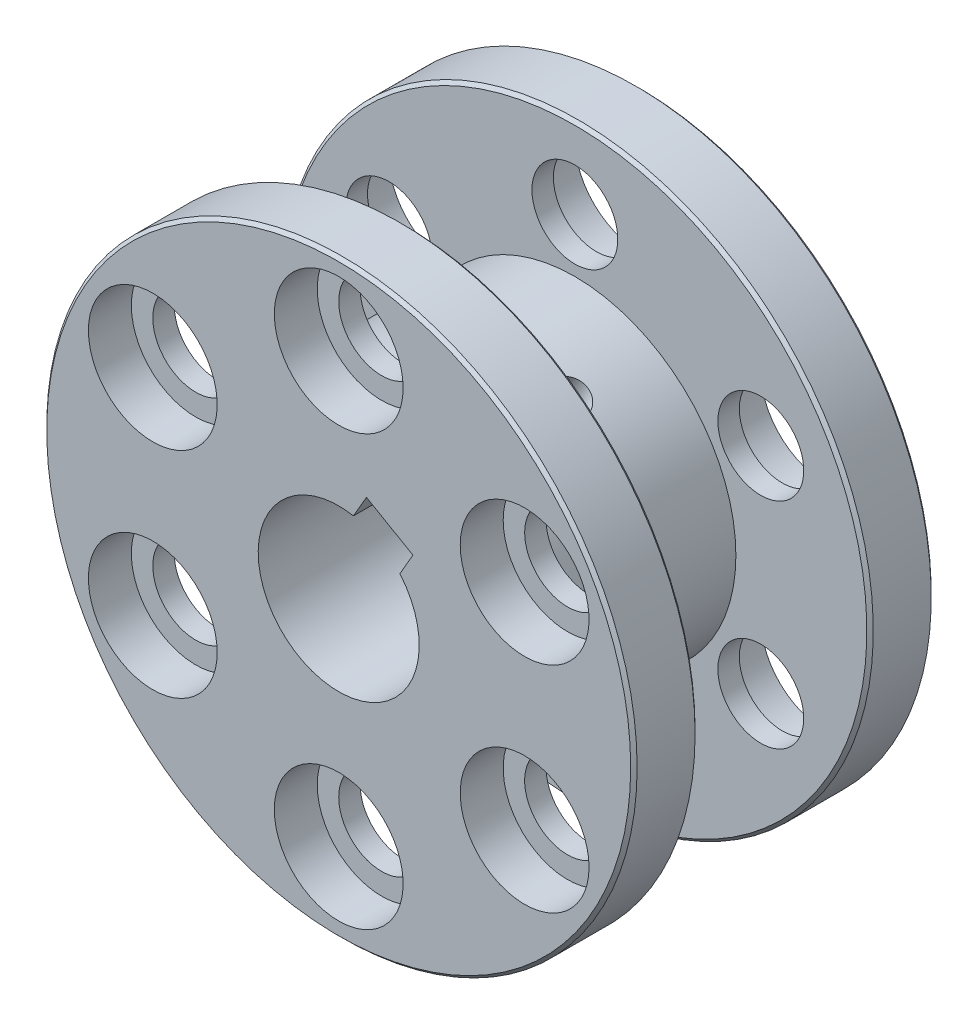
from build123d import *

# Parameters (mm, degrees)
EXTRUDE_1_OUTLINE_R       = 27.5
EXTRUDE_1_DEPTH           = 6
SKETCH_2_R                = 6
CUT_EXTRUDE_1_DEPTH       = 4
SKETCH_3_R                = 4
CUT_EXTRUDE_2_DEPTH       = 40.096035605
PATTERN_CIRCULAR_1_COUNT  = 6
SKETCH_4_R                = 15
EXTRUDE_2_DEPTH           = 16
MIRROR_1_COPY_1_SKETCH_R  = 6
MIRROR_1_COPY_1_DEPTH     = 4
MIRROR_1_COPY_2_SKETCH_R  = 6
MIRROR_1_COPY_2_DEPTH     = 4
MIRROR_1_COPY_3_SKETCH_R  = 6
MIRROR_1_COPY_3_DEPTH     = 4
MIRROR_1_COPY_4_SKETCH_R  = 6
MIRROR_1_COPY_4_DEPTH     = 4
MIRROR_1_COPY_5_SKETCH_R  = 6
MIRROR_1_COPY_5_DEPTH     = 4
MIRROR_1_COPY_6_SKETCH_R  = 4
MIRROR_1_COPY_6_DEPTH     = 40.096035605
MIRROR_1_COPY_7_SKETCH_R  = 4
MIRROR_1_COPY_7_DEPTH     = 40.096035605
MIRROR_1_COPY_8_SKETCH_R  = 4
MIRROR_1_COPY_8_DEPTH     = 40.096035605
MIRROR_1_COPY_9_SKETCH_R  = 4
MIRROR_1_COPY_9_DEPTH     = 40.096035605
MIRROR_1_COPY_10_SKETCH_R = 4
MIRROR_1_COPY_10_DEPTH    = 40.096035605
CUT_EXTRUDE_3_DEPTH       = 48.921811318
CHAMFER_1_SIZE            = 0.3
SKETCH_7_W                = 1.65
SKETCH_7_H                = 28.065698604


# Read off the part's stored shape, not the designer's step: 凸台-拉伸1
with BuildPart() as part:
    # 凸台-拉伸1 outline → 凸台-拉伸1 (new body)
    with BuildSketch(Plane.XY):
        Circle(EXTRUDE_1_OUTLINE_R)
    extrude_1 = extrude(amount=EXTRUDE_1_DEPTH)

    # 草图2 → 切除-拉伸1 (cut)
    with BuildSketch(Plane.XY.offset(6)):
        with Locations((0, 20)):
            Circle(SKETCH_2_R)
    cut_extrude_1 = extrude(amount=-CUT_EXTRUDE_1_DEPTH, mode=Mode.SUBTRACT)

    # 草图3 → 切除-拉伸2 (cut, through all)
    with BuildSketch(Plane.XY.offset(2)):
        with Locations((0, 20)):
            Circle(SKETCH_3_R)
    cut_extrude_2 = extrude(amount=-CUT_EXTRUDE_2_DEPTH, mode=Mode.SUBTRACT)

    # 阵列(圆周)1: 切除-拉伸1, 切除-拉伸2 ×6 about axis
    pattern_circular_1_axis = Axis((0, 0, 0), (0, 0, 1))
    add([cut_extrude_1.rotate(pattern_circular_1_axis, i * 360 / PATTERN_CIRCULAR_1_COUNT) for i in range(1, PATTERN_CIRCULAR_1_COUNT)], mode=Mode.SUBTRACT)
    add([cut_extrude_2.rotate(pattern_circular_1_axis, i * 360 / PATTERN_CIRCULAR_1_COUNT) for i in range(1, PATTERN_CIRCULAR_1_COUNT)], mode=Mode.SUBTRACT)

    # 草图4 → 凸台-拉伸2 (add)
    with BuildSketch(Plane(origin=(0, 0, 0), x_dir=(-1, 0, 0), z_dir=(0, 0, -1))):
        with Locations(Location((0, 0, 0), (0, 0, 180))):
            Circle(SKETCH_4_R)
    extrude(amount=EXTRUDE_2_DEPTH)

    # 镜向1: 凸台-拉伸1, 切除-拉伸1, 切除-拉伸2 across plane
    add(extrude_1.mirror(Plane(origin=(0, 0, -8), x_dir=(1, 0, 0), z_dir=(0, 0, -1))))
    add(cut_extrude_1.mirror(Plane(origin=(0, 0, -8), x_dir=(1, 0, 0), z_dir=(0, 0, -1))), mode=Mode.SUBTRACT)
    add(cut_extrude_2.mirror(Plane(origin=(0, 0, -8), x_dir=(1, 0, 0), z_dir=(0, 0, -1))), mode=Mode.SUBTRACT)

    # 镜向1 copy 1 sketch → 镜向1 copy 1 (cut)
    with BuildSketch(Plane(origin=(0, 0, -22), x_dir=(0.5000000000000001, 0.8660254037844386, 0), z_dir=(0, 0, -1))):
        with Locations((0, -20)):
            Circle(MIRROR_1_COPY_1_SKETCH_R)
    extrude(amount=-MIRROR_1_COPY_1_DEPTH, mode=Mode.SUBTRACT)

    # 镜向1 copy 2 sketch → 镜向1 copy 2 (cut)
    with BuildSketch(Plane(origin=(0, 0, -22), x_dir=(-0.4999999999999998, 0.8660254037844387, 0), z_dir=(0, 0, -1))):
        with Locations((0, -20)):
            Circle(MIRROR_1_COPY_2_SKETCH_R)
    extrude(amount=-MIRROR_1_COPY_2_DEPTH, mode=Mode.SUBTRACT)

    # 镜向1 copy 3 sketch → 镜向1 copy 3 (cut)
    with BuildSketch(Plane(origin=(0, 0, -22), x_dir=(-1, 0, 0), z_dir=(0, 0, -1))):
        with Locations((0, -20)):
            Circle(MIRROR_1_COPY_3_SKETCH_R)
    extrude(amount=-MIRROR_1_COPY_3_DEPTH, mode=Mode.SUBTRACT)

    # 镜向1 copy 4 sketch → 镜向1 copy 4 (cut)
    with BuildSketch(Plane(origin=(0, 0, -22), x_dir=(-0.5000000000000004, -0.8660254037844384, 0), z_dir=(0, 0, -1))):
        with Locations((0, -20)):
            Circle(MIRROR_1_COPY_4_SKETCH_R)
    extrude(amount=-MIRROR_1_COPY_4_DEPTH, mode=Mode.SUBTRACT)

    # 镜向1 copy 5 sketch → 镜向1 copy 5 (cut)
    with BuildSketch(Plane(origin=(0, 0, -22), x_dir=(0.5000000000000001, -0.8660254037844386, 0), z_dir=(0, 0, -1))):
        with Locations((0, -20)):
            Circle(MIRROR_1_COPY_5_SKETCH_R)
    extrude(amount=-MIRROR_1_COPY_5_DEPTH, mode=Mode.SUBTRACT)

    # 镜向1 copy 6 sketch → 镜向1 copy 6 (cut, through all)
    with BuildSketch(Plane(origin=(0, 0, -18), x_dir=(0.5000000000000001, 0.8660254037844386, 0), z_dir=(0, 0, -1))):
        with Locations((0, -20)):
            Circle(MIRROR_1_COPY_6_SKETCH_R)
    extrude(amount=-MIRROR_1_COPY_6_DEPTH, mode=Mode.SUBTRACT)

    # 镜向1 copy 7 sketch → 镜向1 copy 7 (cut, through all)
    with BuildSketch(Plane(origin=(0, 0, -18), x_dir=(-0.4999999999999998, 0.8660254037844387, 0), z_dir=(0, 0, -1))):
        with Locations((0, -20)):
            Circle(MIRROR_1_COPY_7_SKETCH_R)
    extrude(amount=-MIRROR_1_COPY_7_DEPTH, mode=Mode.SUBTRACT)

    # 镜向1 copy 8 sketch → 镜向1 copy 8 (cut, through all)
    with BuildSketch(Plane(origin=(0, 0, -18), x_dir=(-1, 0, 0), z_dir=(0, 0, -1))):
        with Locations((0, -20)):
            Circle(MIRROR_1_COPY_8_SKETCH_R)
    extrude(amount=-MIRROR_1_COPY_8_DEPTH, mode=Mode.SUBTRACT)

    # 镜向1 copy 9 sketch → 镜向1 copy 9 (cut, through all)
    with BuildSketch(Plane(origin=(0, 0, -18), x_dir=(-0.5000000000000004, -0.8660254037844384, 0), z_dir=(0, 0, -1))):
        with Locations((0, -20)):
            Circle(MIRROR_1_COPY_9_SKETCH_R)
    extrude(amount=-MIRROR_1_COPY_9_DEPTH, mode=Mode.SUBTRACT)

    # 镜向1 copy 10 sketch → 镜向1 copy 10 (cut, through all)
    with BuildSketch(Plane(origin=(0, 0, -18), x_dir=(0.5000000000000001, -0.8660254037844386, 0), z_dir=(0, 0, -1))):
        with Locations((0, -20)):
            Circle(MIRROR_1_COPY_10_SKETCH_R)
    extrude(amount=-MIRROR_1_COPY_10_DEPTH, mode=Mode.SUBTRACT)

    # 草图5 → 切除-拉伸3 (cut, through all)
    with BuildSketch(Plane.XY.offset(6)):
        with BuildLine():
            Line((6.915063509, 6.977241336), (2.584936491, 9.477241336))
            Line((2.584936491, 9.477241336), (1.370470396, 7.373724357))
            ThreePointArc((1.370470396, 7.373724357), (-3.75, -6.495190528), (5.700597415, 4.873724357))
            Line((5.700597415, 4.873724357), (6.915063509, 6.977241336))
        make_face()
    extrude(amount=-CUT_EXTRUDE_3_DEPTH, mode=Mode.SUBTRACT)

    # 倒角1
    chamfer_1_edges = [part.edges().sort_by_distance(p)[0] for p in [
        (-27.5, 0, 0),
        (-27.5, 0, 6),
        (-27.5, 0, -16),
        (-27.5, 0, -22),
    ]]
    chamfer(chamfer_1_edges, length=CHAMFER_1_SIZE)

    # 草图7 → M4 螺纹孔1 (revolve, cut)
    with BuildSketch(Plane(origin=(4.75, 8.227241336, -8.001910076), x_dir=(0.866025403784438, -0.5000000000000012, 0), z_dir=(0, 0, 1))):
        with Locations((0.825, 14.032849302)):
            Rectangle(SKETCH_7_W, SKETCH_7_H)
    revolve(axis=Axis((1.575, 2.727980022, -8.001910076), (0.5000000000000012, 0.8660254037844379, 0)), mode=Mode.SUBTRACT)


solid = part.part
